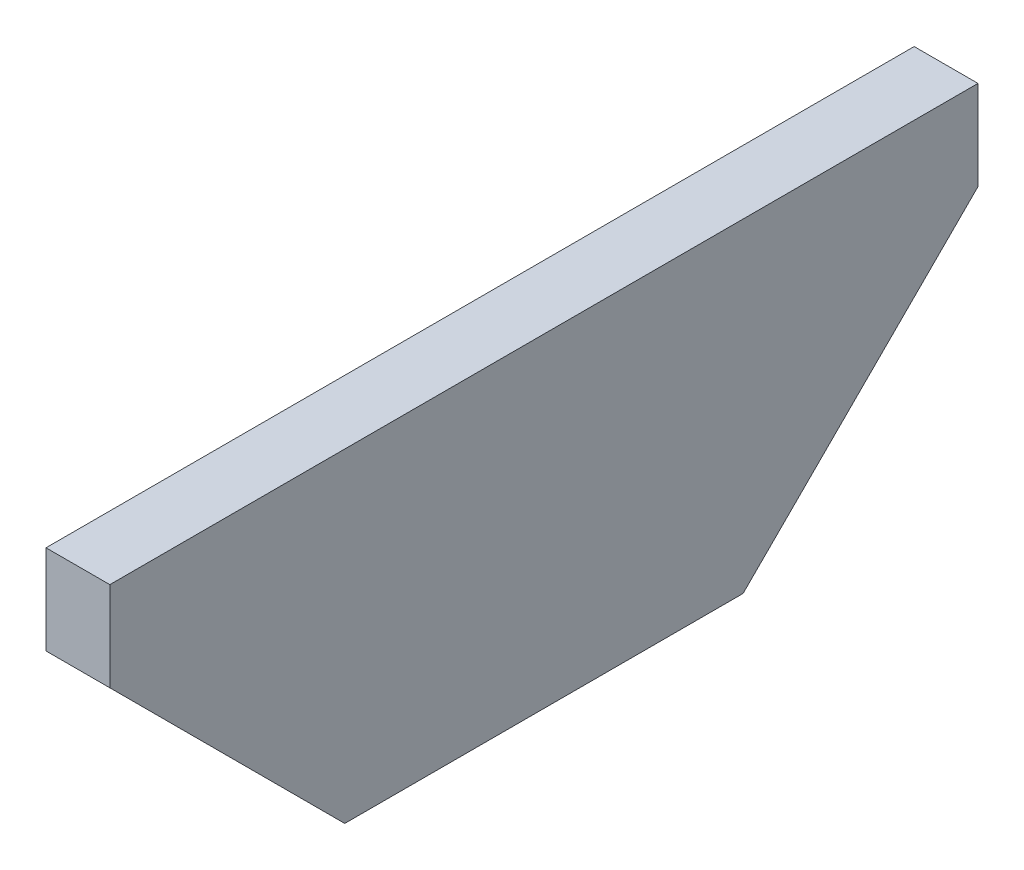
from build123d import *

# Parameters (mm, degrees)
STOCK_TEST_FINGER_MICHELLE_V2_1_START = -21.07817965
STOCK_TEST_FINGER_MICHELLE_V2_1_DEPTH = 2.5
CUT_EXTRUDE1_START                    = -1.5
SKETCH1_R                             = 1.75
CUT_EXTRUDE1_DEPTH                    = 1.5


# Read off the part's stored shape, not the designer's step: Stock-test_finger_michelle_V2-1
with BuildPart() as part:
    # Stock-test_finger_michelle_V2-1 outline → Stock-test_finger_michelle_V2-1 (new body)
    with BuildSketch(Plane.YZ.offset(STOCK_TEST_FINGER_MICHELLE_V2_1_START)):
        Polygon((0, -6.34419618), (9.2, -15.54419618), (12.7, -15.54419618), (12.7, 18.45580382), (9.2, 18.45580382), (0, 9.25580382), align=None)
    extrude(amount=STOCK_TEST_FINGER_MICHELLE_V2_1_DEPTH)

    # Sketch1 → Cut-Extrude1 (cut)
    with BuildSketch(Plane.ZY.offset(21.07817965).offset(CUT_EXTRUDE1_START)):
        with Locations(Location((-12.29419618, 9.2, 0), (0, 0, 180))):
            Circle(SKETCH1_R)
        with Locations(Location((15.20580382, 9.2, 0), (0, 0, 180))):
            Circle(SKETCH1_R)
    extrude(amount=CUT_EXTRUDE1_DEPTH, mode=Mode.SUBTRACT)


solid = part.part
